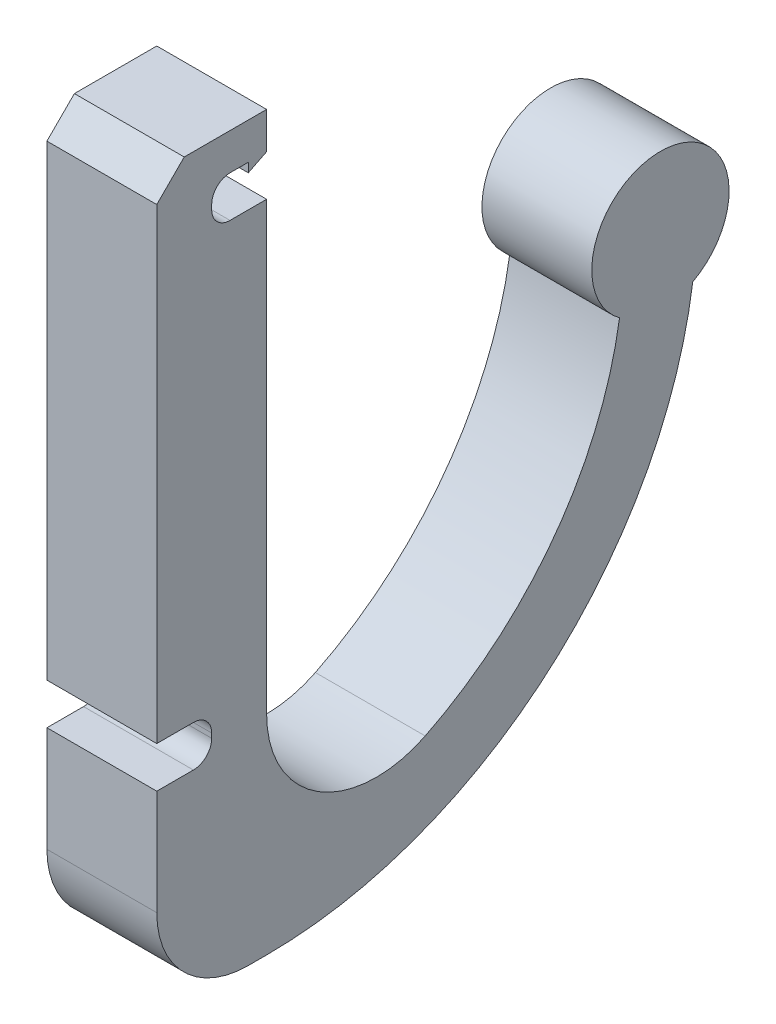
from build123d import *

# Parameters (mm, degrees)
BOSS_EXTRUDE1_DEPTH = 12
FILLET1_R           = 12
FILLET2_R           = 10
SKETCH3_W           = 6
SKETCH3_H           = 4.5
CUT_EXTRUDE1_DEPTH  = 12
FILLET3_R           = 2
CHAMFER1_SIZE       = 3
BOSS_EXTRUDE2_DEPTH = 12


with BuildPart() as part:
    # Sketch2 → Boss-Extrude1 (new body)
    with BuildSketch(Plane(origin=(0, 0, 0), x_dir=(0, 0, -1), z_dir=(1, 0, 0))):
        with BuildLine():
            Line((-6, 40), (6, 40))
            Line((6, 40), (6, -32))
            ThreePointArc((6, -32), (31.376089713, -22.623144998), (44.55766945, 1.001361229))
            ThreePointArc((44.55766945, 1.001361229), (49.578973365, 14.504959969), (52.55766945, 0.409285399))
            ThreePointArc((52.55766945, 0.409285399), (36.824206929, -28.488778663), (6, -40))
            Line((6, -40), (-6, -40))
            Line((-6, -40), (-6, 40))
        make_face()
    extrude(amount=BOSS_EXTRUDE1_DEPTH)

    # Fillet1
    fillet1_edges = [part.edges().sort_by_distance(p)[0] for p in [
        (6, -32, -6),
    ]]
    fillet(fillet1_edges, radius=FILLET1_R)

    # Fillet2
    fillet2_edges = [part.edges().sort_by_distance(p)[0] for p in [
        (6, -40, 6),
    ]]
    fillet(fillet2_edges, radius=FILLET2_R)

    # Sketch3 → Cut-Extrude1 (cut)
    with BuildSketch(Plane(origin=(12, 0, 0), x_dir=(0, 0, -1), z_dir=(1, 0, 0))):
        with Locations((-3, -16.25)):
            Rectangle(SKETCH3_W, SKETCH3_H)
        with Locations((3, 33.75)):
            Rectangle(SKETCH3_W, SKETCH3_H)
    extrude(amount=-CUT_EXTRUDE1_DEPTH, mode=Mode.SUBTRACT)

    # Fillet3
    fillet3_edges = [part.edges().sort_by_distance(p)[0] for p in [
        (6, 36, 0),
        (6, 31.5, 0),
        (6, -18.5, 0),
        (6, -14, 0),
    ]]
    fillet(fillet3_edges, radius=FILLET3_R)

    # Chamfer1
    chamfer1_edges = [part.edges().sort_by_distance(p)[0] for p in [
        (6, 40, 6),
    ]]
    chamfer(chamfer1_edges, length=CHAMFER1_SIZE)

    # Sketch4 → Boss-Extrude2 (add)
    with BuildSketch(Plane(origin=(12, 0, 0), x_dir=(0, 0, -1), z_dir=(1, 0, 0))):
        Polygon((4, 36), (4, 35), (6, 36), align=None)
    extrude(amount=-BOSS_EXTRUDE2_DEPTH)


solid = part.part
